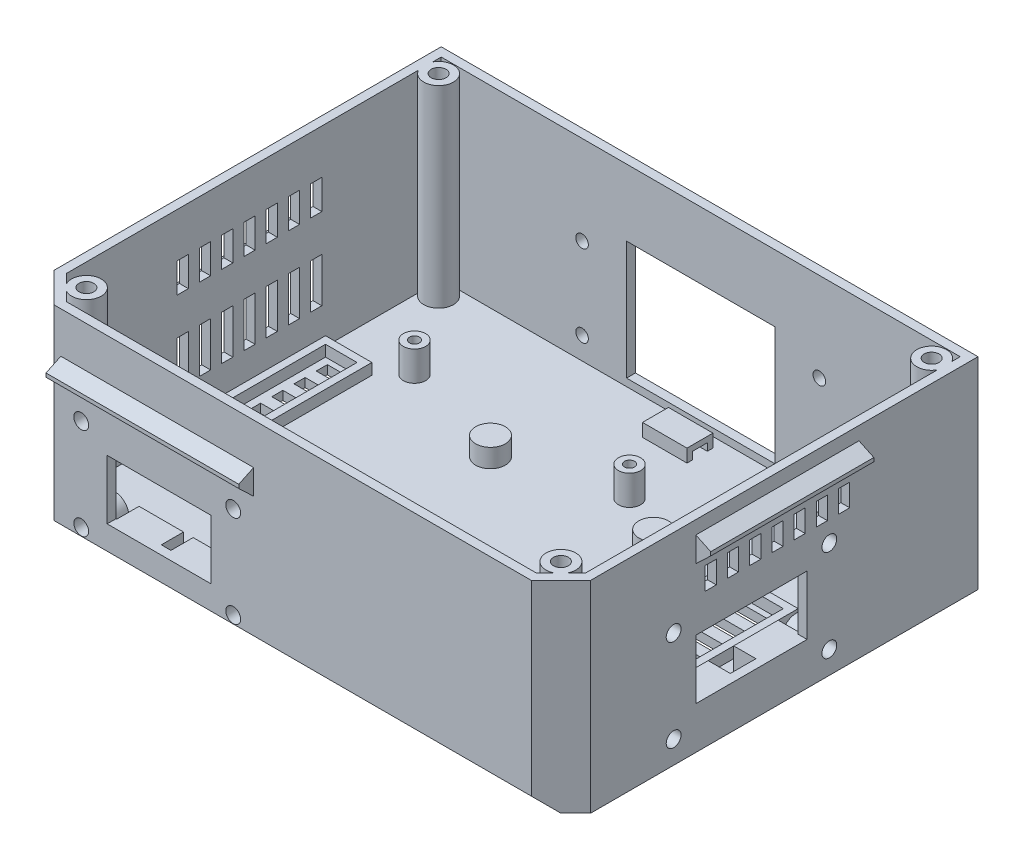
from build123d import *

# Parameters (mm, degrees)
BOX_BLOCK_DEPTH                     = 54.4
REAR_BOTTOM_FACET_DEPTH             = 147.709508894
REAR_BOTTOM_FACET_DEPTH_BACK        = 147.709508894
SHELL_T                             = -2.4
SKETCH3_R                           = 1.7
SKETCH3_W                           = 40
SKETCH3_H                           = 32
CABLE_WINDOW_AND_FLANGE_HOLES_DEPTH = 3.4
SKETCH4_R                           = 3
PI_STANDOFFS_DEPTH                  = 8.5
SKETCH5_R                           = 1.35
PI_SCREW_HOLES_DEPTH                = 11.4
SKETCH6_R                           = 2.75
PI_COUNTERBORES_DEPTH               = 2.7
SKETCH7_R                           = 4
LID_BOSS_1_DEPTH                    = 52.5
SKETCH8_R                           = 4
LID_BOSS_2_DEPTH                    = 52.5
SKETCH9_R                           = 4
LID_BOSS_3_DEPTH                    = 52.5
SKETCH10_R                          = 4
LID_BOSS_4_DEPTH                    = 52.5
SKETCH11_R                          = 2
LID_INSERT_HOLES_DEPTH              = 6.5
SKETCH12_W                          = 20
SKETCH12_H                          = 40
SKETCH12_W_2                        = 16
SKETCH12_H_2                        = 36
INTAKE_UPSTAND_DEPTH                = 3.5
SKETCH13_W                          = 12
SKETCH13_H                          = 3
INTAKE_SLOTS_DEPTH                  = 3.9
SKETCH14_W                          = 12.5
SKETCH14_H                          = 40
SKETCH14_W_2                        = 8.5
SKETCH14_H_2                        = 36
FLOOR_EXHAUST_UPSTAND_DEPTH         = 3.5
SKETCH15_W                          = 4.5
SKETCH15_H                          = 3
FLOOR_EXHAUST_SLOTS_DEPTH           = 3.9
SKETCH16_W                          = 3
SKETCH16_H                          = 12
EXHAUST_VENTS_DEPTH                 = 3.4
EXHAUST_DRIP_LEDGE_DEPTH            = 44
SKETCH18_W                          = 3
SKETCH18_H                          = 8
UPPER_VENTS_L_DEPTH                 = 3.4
UPPER_DRIP_LEDGE_L_DEPTH            = 44
SKETCH20_W                          = 3
SKETCH20_H                          = 6
UPPER_VENTS_R_DEPTH                 = 3.4
UPPER_DRIP_LEDGE_R_DEPTH            = 44
SKETCH22_W                          = 28
SKETCH22_H                          = 16
REAR_PORT_OPENING_DEPTH             = 3.4
SKETCH23_R                          = 4
REAR_PORT_BOSSES_DEPTH              = 6.6
SKETCH24_R                          = 2
REAR_PORT_INSERT_HOLES_DEPTH        = 7
REAR_PORT_DRIP_LEDGE_DEPTH          = 52
SKETCH26_W                          = 12
SKETCH26_H                          = 6.1
REAR_TIE_BLOCK_USBC_DEPTH           = 8.5
SKETCH27_W                          = 3
SKETCH27_H                          = 2
REAR_TIE_TUNNEL_USBC_DEPTH          = 14
SKETCH28_W                          = 12
SKETCH28_H                          = 6.1
REAR_TIE_BLOCK_HDMI_DEPTH           = 8.5
SKETCH29_W                          = 3
SKETCH29_H                          = 2
REAR_TIE_TUNNEL_HDMI_DEPTH          = 14
SKETCH30_W                          = 30
SKETCH30_H                          = 16
SIDE_PORT_OPENING_DEPTH             = 3.4
SKETCH31_R                          = 4
SIDE_PORT_BOSSES_DEPTH              = 6.6
SKETCH32_R                          = 2
SIDE_PORT_INSERT_HOLES_DEPTH        = 7
SKETCH33_W                          = 6.1
SKETCH33_H                          = 12
SIDE_TIE_BLOCK_ETH_DEPTH            = 9.5
SKETCH34_W                          = 3
SKETCH34_H                          = 2
SIDE_TIE_TUNNEL_ETH_DEPTH           = 14
SKETCH35_W                          = 6.1
SKETCH35_H                          = 12
SIDE_TIE_BLOCK_USBA_DEPTH           = 9.5
SKETCH36_W                          = 3
SKETCH36_H                          = 2
SIDE_TIE_TUNNEL_USBA_DEPTH          = 14
SKETCH37_W                          = 12
SKETCH37_H                          = 7
BUNDLE_TIE_ANCHOR_DEPTH             = 4
SKETCH38_W                          = 4
SKETCH38_H                          = 2
BUNDLE_TIE_SLOT_DEPTH               = 14
SKETCH39_R                          = 4
RAIL_PLATE_BOSSES_DEPTH             = 5.5
SKETCH40_R                          = 2
RAIL_INSERT_HOLES_DEPTH             = 6.5


with BuildPart() as part:
    # Sketch1 → Box Block (new body)
    with BuildSketch(Plane(origin=(0, -28.4, 0), x_dir=(1, 0, 0), z_dir=(0, 1, 0))):
        Polygon((-64.4, -124.4), (64.4, -124.4), (72.4, -116.4), (72.4, -11.9), (-72.4, -11.9), (-72.4, -116.4), align=None)
    extrude(amount=BOX_BLOCK_DEPTH)

    # Sketch2 → Rear Bottom Facet (cut, two sides: drawn at the far end of the back side and taken through both)
    with BuildSketch(Plane(origin=(0, 0, 0), x_dir=(0, 0, -1), z_dir=(1, 0, 0)).offset(-REAR_BOTTOM_FACET_DEPTH_BACK)):
        Polygon((-125.4, -23.4), (-119.4, -29.4), (-125.4, -29.4), align=None)
    extrude(amount=REAR_BOTTOM_FACET_DEPTH + REAR_BOTTOM_FACET_DEPTH_BACK, mode=Mode.SUBTRACT)

    # Shell
    shell_openings = [part.faces().sort_by_distance(p)[0] for p in [
        (0, 26, 67.938651958),
    ]]
    offset(amount=SHELL_T, openings=shell_openings, kind=Kind.INTERSECTION)

    # Sketch3 → Cable Window and Flange Holes (cut)
    with BuildSketch(Plane.XY.offset(11.4)):
        with Locations((-32, 2)):
            Circle(SKETCH3_R)
        with Locations((32, 2)):
            Circle(SKETCH3_R)
        with Locations((-32, -20)):
            Circle(SKETCH3_R)
        with Locations((32, -20)):
            Circle(SKETCH3_R)
        with Locations((0, -8)):
            Rectangle(SKETCH3_W, SKETCH3_H)
    extrude(amount=CABLE_WINDOW_AND_FLANGE_HOLES_DEPTH, mode=Mode.SUBTRACT)

    # Sketch4 → Pi Standoffs (add)
    with BuildSketch(Plane(origin=(0, -26.5, 0), x_dir=(1, 0, 0), z_dir=(0, 1, 0))):
        with Locations((-51.5, -89)):
            Circle(SKETCH4_R)
        with Locations((6.5, -89)):
            Circle(SKETCH4_R)
        with Locations((-51.5, -40)):
            Circle(SKETCH4_R)
        with Locations((6.5, -40)):
            Circle(SKETCH4_R)
    extrude(amount=PI_STANDOFFS_DEPTH)

    # Sketch5 → Pi Screw Holes (cut)
    with BuildSketch(Plane(origin=(0, -28.9, 0), x_dir=(1, 0, 0), z_dir=(0, 1, 0))):
        with Locations((-51.5, -89)):
            Circle(SKETCH5_R)
        with Locations((6.5, -89)):
            Circle(SKETCH5_R)
        with Locations((-51.5, -40)):
            Circle(SKETCH5_R)
        with Locations((6.5, -40)):
            Circle(SKETCH5_R)
    extrude(amount=PI_SCREW_HOLES_DEPTH, mode=Mode.SUBTRACT)

    # Sketch6 → Pi Counterbores (cut)
    with BuildSketch(Plane(origin=(0, -28.9, 0), x_dir=(1, 0, 0), z_dir=(0, 1, 0))):
        with Locations((-51.5, -89)):
            Circle(SKETCH6_R)
        with Locations((6.5, -89)):
            Circle(SKETCH6_R)
        with Locations((-51.5, -40)):
            Circle(SKETCH6_R)
        with Locations((6.5, -40)):
            Circle(SKETCH6_R)
    extrude(amount=PI_COUNTERBORES_DEPTH, mode=Mode.SUBTRACT)

    # Sketch7 → Lid Boss 1 (add)
    with BuildSketch(Plane(origin=(0, -26.5, 0), x_dir=(1, 0, 0), z_dir=(0, 1, 0))):
        with Locations((-66.5, -18.5)):
            Circle(SKETCH7_R)
    extrude(amount=LID_BOSS_1_DEPTH)

    # Sketch8 → Lid Boss 2 (add)
    with BuildSketch(Plane(origin=(0, -26.5, 0), x_dir=(1, 0, 0), z_dir=(0, 1, 0))):
        with Locations((66.5, -18.5)):
            Circle(SKETCH8_R)
    extrude(amount=LID_BOSS_2_DEPTH)

    # Sketch9 → Lid Boss 3 (add)
    with BuildSketch(Plane(origin=(0, -26.5, 0), x_dir=(1, 0, 0), z_dir=(0, 1, 0))):
        with Locations((-64, -116)):
            Circle(SKETCH9_R)
    extrude(amount=LID_BOSS_3_DEPTH)

    # Sketch10 → Lid Boss 4 (add)
    with BuildSketch(Plane(origin=(0, -26.5, 0), x_dir=(1, 0, 0), z_dir=(0, 1, 0))):
        with Locations((64, -116)):
            Circle(SKETCH10_R)
    extrude(amount=LID_BOSS_4_DEPTH)

    # Sketch11 → Lid Insert Holes (cut)
    with BuildSketch(Plane(origin=(0, 20, 0), x_dir=(1, 0, 0), z_dir=(0, 1, 0))):
        with Locations((-66.5, -18.5)):
            Circle(SKETCH11_R)
        with Locations((66.5, -18.5)):
            Circle(SKETCH11_R)
        with Locations((-64, -116)):
            Circle(SKETCH11_R)
        with Locations((64, -116)):
            Circle(SKETCH11_R)
    extrude(amount=LID_INSERT_HOLES_DEPTH, mode=Mode.SUBTRACT)

    # Sketch12 → Intake Upstand (add)
    with BuildSketch(Plane(origin=(0, -26.5, 0), x_dir=(1, 0, 0), z_dir=(0, 1, 0))):
        with Locations((48, -66)):
            Rectangle(SKETCH12_W, SKETCH12_H)
        with Locations((48, -66)):
            Rectangle(SKETCH12_W_2, SKETCH12_H_2, mode=Mode.SUBTRACT)
    extrude(amount=INTAKE_UPSTAND_DEPTH)

    # Sketch13 → Intake Slots (cut)
    with BuildSketch(Plane(origin=(0, -29.4, 0), x_dir=(1, 0, 0), z_dir=(0, 1, 0))):
        with Locations((48, -81)):
            Rectangle(SKETCH13_W, SKETCH13_H)
        with Locations((48, -75)):
            Rectangle(SKETCH13_W, SKETCH13_H)
        with Locations((48, -69)):
            Rectangle(SKETCH13_W, SKETCH13_H)
        with Locations((48, -63)):
            Rectangle(SKETCH13_W, SKETCH13_H)
        with Locations((48, -57)):
            Rectangle(SKETCH13_W, SKETCH13_H)
        with Locations((48, -51)):
            Rectangle(SKETCH13_W, SKETCH13_H)
    extrude(amount=INTAKE_SLOTS_DEPTH, mode=Mode.SUBTRACT)

    # Sketch14 → Floor Exhaust Upstand (add)
    with BuildSketch(Plane(origin=(0, -26.5, 0), x_dir=(1, 0, 0), z_dir=(0, 1, 0))):
        with Locations((-63.25, -66)):
            Rectangle(SKETCH14_W, SKETCH14_H)
        with Locations((-63.25, -66)):
            Rectangle(SKETCH14_W_2, SKETCH14_H_2, mode=Mode.SUBTRACT)
    extrude(amount=FLOOR_EXHAUST_UPSTAND_DEPTH)

    # Sketch15 → Floor Exhaust Slots (cut)
    with BuildSketch(Plane(origin=(0, -29.4, 0), x_dir=(1, 0, 0), z_dir=(0, 1, 0))):
        with Locations((-63.25, -81)):
            Rectangle(SKETCH15_W, SKETCH15_H)
        with Locations((-63.25, -75)):
            Rectangle(SKETCH15_W, SKETCH15_H)
        with Locations((-63.25, -69)):
            Rectangle(SKETCH15_W, SKETCH15_H)
        with Locations((-63.25, -63)):
            Rectangle(SKETCH15_W, SKETCH15_H)
        with Locations((-63.25, -57)):
            Rectangle(SKETCH15_W, SKETCH15_H)
        with Locations((-63.25, -51)):
            Rectangle(SKETCH15_W, SKETCH15_H)
    extrude(amount=FLOOR_EXHAUST_SLOTS_DEPTH, mode=Mode.SUBTRACT)

    # Sketch16 → Exhaust Vents (cut)
    with BuildSketch(Plane(origin=(-72.9, 0, 0), x_dir=(0, 0, -1), z_dir=(1, 0, 0))):
        with Locations((-84, -10)):
            Rectangle(SKETCH16_W, SKETCH16_H)
        with Locations((-78, -10)):
            Rectangle(SKETCH16_W, SKETCH16_H)
        with Locations((-72, -10)):
            Rectangle(SKETCH16_W, SKETCH16_H)
        with Locations((-66, -10)):
            Rectangle(SKETCH16_W, SKETCH16_H)
        with Locations((-60, -10)):
            Rectangle(SKETCH16_W, SKETCH16_H)
        with Locations((-54, -10)):
            Rectangle(SKETCH16_W, SKETCH16_H)
        with Locations((-48, -10)):
            Rectangle(SKETCH16_W, SKETCH16_H)
    extrude(amount=EXHAUST_VENTS_DEPTH, mode=Mode.SUBTRACT)

    # Sketch17 → Exhaust Drip Ledge (add)
    with BuildSketch(Plane.XY.offset(44)):
        Polygon((-72.2, -2.5), (-76.4, 1.5), (-76.4, 2.5), (-72.2, 4.5), align=None)
    extrude(amount=EXHAUST_DRIP_LEDGE_DEPTH)

    # Sketch18 → Upper Vents L (cut)
    with BuildSketch(Plane(origin=(-72.9, 0, 0), x_dir=(0, 0, -1), z_dir=(1, 0, 0))):
        with Locations((-84, 10)):
            Rectangle(SKETCH18_W, SKETCH18_H)
        with Locations((-78, 10)):
            Rectangle(SKETCH18_W, SKETCH18_H)
        with Locations((-72, 10)):
            Rectangle(SKETCH18_W, SKETCH18_H)
        with Locations((-66, 10)):
            Rectangle(SKETCH18_W, SKETCH18_H)
        with Locations((-60, 10)):
            Rectangle(SKETCH18_W, SKETCH18_H)
        with Locations((-54, 10)):
            Rectangle(SKETCH18_W, SKETCH18_H)
        with Locations((-48, 10)):
            Rectangle(SKETCH18_W, SKETCH18_H)
    extrude(amount=UPPER_VENTS_L_DEPTH, mode=Mode.SUBTRACT)

    # Sketch19 → Upper Drip Ledge L (add)
    with BuildSketch(Plane.XY.offset(44)):
        Polygon((-72.2, 15.5), (-76.4, 19.5), (-76.4, 20.5), (-72.2, 22.5), align=None)
    extrude(amount=UPPER_DRIP_LEDGE_L_DEPTH)

    # Sketch20 → Upper Vents R (cut)
    with BuildSketch(Plane(origin=(69.5, 0, 0), x_dir=(0, 0, -1), z_dir=(1, 0, 0))):
        with Locations((-84, 11)):
            Rectangle(SKETCH20_W, SKETCH20_H)
        with Locations((-78, 11)):
            Rectangle(SKETCH20_W, SKETCH20_H)
        with Locations((-72, 11)):
            Rectangle(SKETCH20_W, SKETCH20_H)
        with Locations((-66, 11)):
            Rectangle(SKETCH20_W, SKETCH20_H)
        with Locations((-60, 11)):
            Rectangle(SKETCH20_W, SKETCH20_H)
        with Locations((-54, 11)):
            Rectangle(SKETCH20_W, SKETCH20_H)
        with Locations((-48, 11)):
            Rectangle(SKETCH20_W, SKETCH20_H)
    extrude(amount=UPPER_VENTS_R_DEPTH, mode=Mode.SUBTRACT)

    # Sketch21 → Upper Drip Ledge R (add)
    with BuildSketch(Plane.XY.offset(44)):
        Polygon((72.2, 15.5), (76.4, 19.5), (76.4, 20.5), (72.2, 22.5), align=None)
    extrude(amount=UPPER_DRIP_LEDGE_R_DEPTH)

    # Sketch22 → Rear Port Opening (cut)
    with BuildSketch(Plane.XY.offset(121.5)):
        with Locations((-36, -10)):
            Rectangle(SKETCH22_W, SKETCH22_H)
    extrude(amount=REAR_PORT_OPENING_DEPTH, mode=Mode.SUBTRACT)

    # Sketch23 → Rear Port Bosses (add)
    with BuildSketch(Plane.XY.offset(115.5)):
        with Locations((-57, -22.3)):
            Circle(SKETCH23_R)
        with Locations((-57, 2.5)):
            Circle(SKETCH23_R)
        with Locations((-16, -22.3)):
            Circle(SKETCH23_R)
        with Locations((-16, 2.5)):
            Circle(SKETCH23_R)
    extrude(amount=REAR_PORT_BOSSES_DEPTH)

    # Sketch24 → Rear Port Insert Holes (cut)
    with BuildSketch(Plane.XY.offset(117.9)):
        with Locations((-57, -22.3)):
            Circle(SKETCH24_R)
        with Locations((-57, 2.5)):
            Circle(SKETCH24_R)
        with Locations((-16, -22.3)):
            Circle(SKETCH24_R)
        with Locations((-16, 2.5)):
            Circle(SKETCH24_R)
    extrude(amount=REAR_PORT_INSERT_HOLES_DEPTH, mode=Mode.SUBTRACT)

    # Sketch25 → Rear Port Drip Ledge (add)
    with BuildSketch(Plane(origin=(-62.5, 0, 0), x_dir=(0, 0, -1), z_dir=(1, 0, 0))):
        Polygon((-124.2, 8), (-128.4, 12), (-128.4, 13), (-124.2, 15), align=None)
    extrude(amount=REAR_PORT_DRIP_LEDGE_DEPTH)

    # Sketch26 → Rear Tie Block usbc (add)
    with BuildSketch(Plane(origin=(0, -26.5, 0), x_dir=(1, 0, 0), z_dir=(0, 1, 0))):
        with Locations((-43.8, -119.05)):
            Rectangle(SKETCH26_W, SKETCH26_H)
    extrude(amount=REAR_TIE_BLOCK_USBC_DEPTH)

    # Sketch27 → Rear Tie Tunnel usbc (cut)
    with BuildSketch(Plane(origin=(-50.8, 0, 0), x_dir=(0, 0, -1), z_dir=(1, 0, 0))):
        with Locations((-119, -23.5)):
            Rectangle(SKETCH27_W, SKETCH27_H)
    extrude(amount=REAR_TIE_TUNNEL_USBC_DEPTH, mode=Mode.SUBTRACT)

    # Sketch28 → Rear Tie Block hdmi (add)
    with BuildSketch(Plane(origin=(0, -26.5, 0), x_dir=(1, 0, 0), z_dir=(0, 1, 0))):
        with Locations((-29.2, -119.05)):
            Rectangle(SKETCH28_W, SKETCH28_H)
    extrude(amount=REAR_TIE_BLOCK_HDMI_DEPTH)

    # Sketch29 → Rear Tie Tunnel hdmi (cut)
    with BuildSketch(Plane(origin=(-36.2, 0, 0), x_dir=(0, 0, -1), z_dir=(1, 0, 0))):
        with Locations((-119, -23.5)):
            Rectangle(SKETCH29_W, SKETCH29_H)
    extrude(amount=REAR_TIE_TUNNEL_HDMI_DEPTH, mode=Mode.SUBTRACT)

    # Sketch30 → Side Port Opening (cut)
    with BuildSketch(Plane(origin=(69.5, 0, 0), x_dir=(0, 0, -1), z_dir=(1, 0, 0))):
        with Locations((-73, -9)):
            Rectangle(SKETCH30_W, SKETCH30_H)
    extrude(amount=SIDE_PORT_OPENING_DEPTH, mode=Mode.SUBTRACT)

    # Sketch31 → Side Port Bosses (add)
    with BuildSketch(Plane(origin=(63.5, 0, 0), x_dir=(0, 0, -1), z_dir=(1, 0, 0))):
        with Locations((-94, -22.3)):
            Circle(SKETCH31_R)
        with Locations((-94, 2.5)):
            Circle(SKETCH31_R)
        with Locations((-52, -22.3)):
            Circle(SKETCH31_R)
        with Locations((-52, 2.5)):
            Circle(SKETCH31_R)
    extrude(amount=SIDE_PORT_BOSSES_DEPTH)

    # Sketch32 → Side Port Insert Holes (cut)
    with BuildSketch(Plane(origin=(65.9, 0, 0), x_dir=(0, 0, -1), z_dir=(1, 0, 0))):
        with Locations((-94, -22.3)):
            Circle(SKETCH32_R)
        with Locations((-94, 2.5)):
            Circle(SKETCH32_R)
        with Locations((-52, -22.3)):
            Circle(SKETCH32_R)
        with Locations((-52, 2.5)):
            Circle(SKETCH32_R)
    extrude(amount=SIDE_PORT_INSERT_HOLES_DEPTH, mode=Mode.SUBTRACT)

    # Sketch33 → Side Tie Block eth (add)
    with BuildSketch(Plane(origin=(0, -26.5, 0), x_dir=(1, 0, 0), z_dir=(0, 1, 0))):
        with Locations((67.05, -82.3)):
            Rectangle(SKETCH33_W, SKETCH33_H)
    extrude(amount=SIDE_TIE_BLOCK_ETH_DEPTH)

    # Sketch34 → Side Tie Tunnel eth (cut)
    with BuildSketch(Plane.XY.offset(75.3)):
        with Locations((67, -23.5)):
            Rectangle(SKETCH34_W, SKETCH34_H)
    extrude(amount=SIDE_TIE_TUNNEL_ETH_DEPTH, mode=Mode.SUBTRACT)

    # Sketch35 → Side Tie Block usba (add)
    with BuildSketch(Plane(origin=(0, -26.5, 0), x_dir=(1, 0, 0), z_dir=(0, 1, 0))):
        with Locations((67.05, -63.4)):
            Rectangle(SKETCH35_W, SKETCH35_H)
    extrude(amount=SIDE_TIE_BLOCK_USBA_DEPTH)

    # Sketch36 → Side Tie Tunnel usba (cut)
    with BuildSketch(Plane.XY.offset(56.4)):
        with Locations((67, -23.5)):
            Rectangle(SKETCH36_W, SKETCH36_H)
    extrude(amount=SIDE_TIE_TUNNEL_USBA_DEPTH, mode=Mode.SUBTRACT)

    # Sketch37 → Bundle Tie Anchor (add)
    with BuildSketch(Plane(origin=(0, -26.5, 0), x_dir=(1, 0, 0), z_dir=(0, 1, 0))):
        with Locations((0, -20.5)):
            Rectangle(SKETCH37_W, SKETCH37_H)
    extrude(amount=BUNDLE_TIE_ANCHOR_DEPTH)

    # Sketch38 → Bundle Tie Slot (cut)
    with BuildSketch(Plane(origin=(-7, 0, 0), x_dir=(0, 0, -1), z_dir=(1, 0, 0))):
        with Locations((-20.5, -25)):
            Rectangle(SKETCH38_W, SKETCH38_H)
    extrude(amount=BUNDLE_TIE_SLOT_DEPTH, mode=Mode.SUBTRACT)

    # Sketch39 → Rail Plate Bosses (add)
    with BuildSketch(Plane(origin=(0, -26.5, 0), x_dir=(1, 0, 0), z_dir=(0, 1, 0))):
        with Locations((-22, -91)):
            Circle(SKETCH39_R)
        with Locations((-22, -49)):
            Circle(SKETCH39_R)
        with Locations((22, -91)):
            Circle(SKETCH39_R)
        with Locations((22, -49)):
            Circle(SKETCH39_R)
    extrude(amount=RAIL_PLATE_BOSSES_DEPTH)

    # Sketch40 → Rail Insert Holes (cut)
    with BuildSketch(Plane(origin=(0, -28.9, 0), x_dir=(1, 0, 0), z_dir=(0, 1, 0))):
        with Locations((-22, -91)):
            Circle(SKETCH40_R)
        with Locations((-22, -49)):
            Circle(SKETCH40_R)
        with Locations((22, -91)):
            Circle(SKETCH40_R)
        with Locations((22, -49)):
            Circle(SKETCH40_R)
    extrude(amount=RAIL_INSERT_HOLES_DEPTH, mode=Mode.SUBTRACT)


solid = part.part
